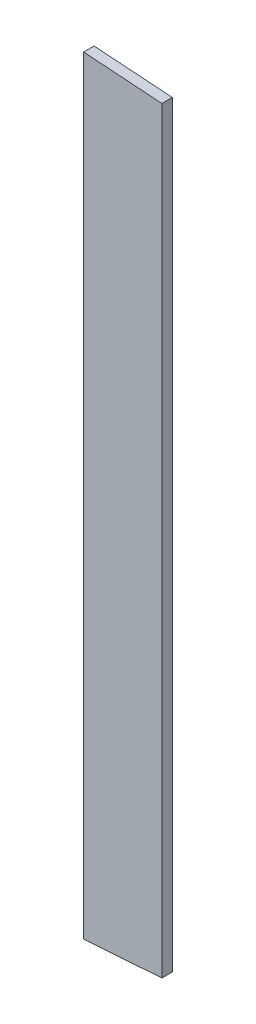
from build123d import *

# Parameters (mm, degrees)
BOSS_EXTRUDE1_DEPTH = 2


with BuildPart() as part:
    # Sketch1 → Boss-Extrude1 (new body)
    with BuildSketch(Plane.XY.offset(3768.949999999)):
        Polygon((-49.769678516, 346.108282384), (-64.769678516, 345.059380205), (-64.769678516, 492.415801833), (-49.769678516, 491.366899654), align=None)
    extrude(amount=BOSS_EXTRUDE1_DEPTH)


solid = part.part
